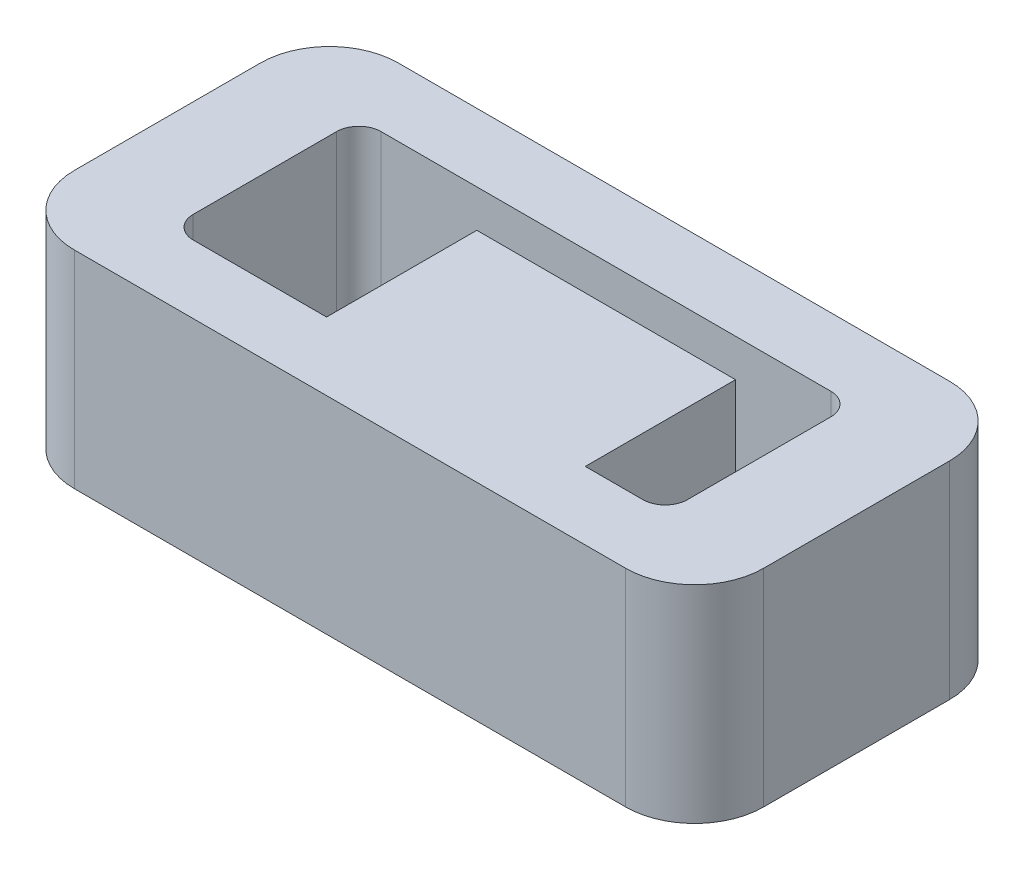
from build123d import *

# Parameters (mm, degrees)
SKETCH2_W                   = 100
SKETCH2_H                   = 47
BOSS_EXTRUDE1_DEPTH         = 30
FILLET1_R                   = 10
CUT_EXTRUDE1_REACH          = 64.867
M6_TAPPED_HOLE1_D           = 5
M6_TAPPED_HOLE1_DEPTH       = 17
M6_TAPPED_HOLE1_CSINK_D     = 6.05
M6_TAPPED_HOLE1_CSINK_ANGLE = 90
M6_TAPPED_HOLE1_TIP         = 1.502151548


with BuildPart() as part:
    # Sketch2 → Boss-Extrude1 (new body)
    with BuildSketch(Plane(origin=(0, 0, 0), x_dir=(1, 0, 0), z_dir=(0, 1, 0))):
        Rectangle(SKETCH2_W, SKETCH2_H)
    extrude(amount=-BOSS_EXTRUDE1_DEPTH)

    # Fillet1
    fillet1_edges = [part.edges().sort_by_distance(p)[0] for p in [
        (-50, -15, -23.5),
        (50, -15, -23.5),
        (50, -15, 23.5),
        (-50, -15, 23.5),
    ]]
    fillet(fillet1_edges, radius=FILLET1_R)

    # Sketch3 → Cut-Extrude1 (cut, up to next)
    with BuildSketch(Plane(origin=(0, 0, 0), x_dir=(1, 0, 0), z_dir=(0, 1, 0)), mode=Mode.PRIVATE) as cut_extrude1_sk1:
        with BuildLine():
            Line((35.855, -10.4), (35.855, 10.4))
            ThreePointArc((35.855, 10.4), (34.908954903, 12.683954903), (32.625, 13.63))
            Line((32.625, 13.63), (-32.625, 13.63))
            ThreePointArc((-32.625, 13.63), (-34.908954903, 12.683954903), (-35.855, 10.4))
            Line((-35.855, 10.4), (-35.855, -10.4))
            ThreePointArc((-35.855, -10.4), (-34.908954903, -12.683954903), (-32.625, -13.63))
            Line((-32.625, -13.63), (-13.275, -13.63))
            Line((-13.275, -13.63), (-13.275, 8.17))
            Line((-13.275, 8.17), (24.265, 8.17))
            Line((24.265, 8.17), (24.265, -13.63))
            Line((24.265, -13.63), (32.625, -13.63))
            ThreePointArc((32.625, -13.63), (34.908954903, -12.683954903), (35.855, -10.4))
        make_face()
    cut_extrude1_tool1 = extrude(cut_extrude1_sk1.sketch, amount=-CUT_EXTRUDE1_REACH, mode=Mode.PRIVATE) & part.part
    add(cut_extrude1_tool1.solids().sort_by_distance((-22.95, 0, 12.862834))[0], mode=Mode.SUBTRACT)

    # M6 Tapped Hole1
    with Locations(Plane(origin=(0, -30, 0), x_dir=(-1, 0, 0), z_dir=(0, -1, 0))):
        with Locations((-43, 16.5), (43, 16.5), (43, -16.5), (-43, -16.5)):
            CounterSinkHole(M6_TAPPED_HOLE1_D / 2, M6_TAPPED_HOLE1_CSINK_D / 2, depth=M6_TAPPED_HOLE1_DEPTH, counter_sink_angle=M6_TAPPED_HOLE1_CSINK_ANGLE)
            with Locations((0, 0, -(M6_TAPPED_HOLE1_DEPTH + M6_TAPPED_HOLE1_TIP / 2))):  # 118° drill point
                Cone(0, M6_TAPPED_HOLE1_D / 2, M6_TAPPED_HOLE1_TIP, mode=Mode.SUBTRACT)


solid = part.part
